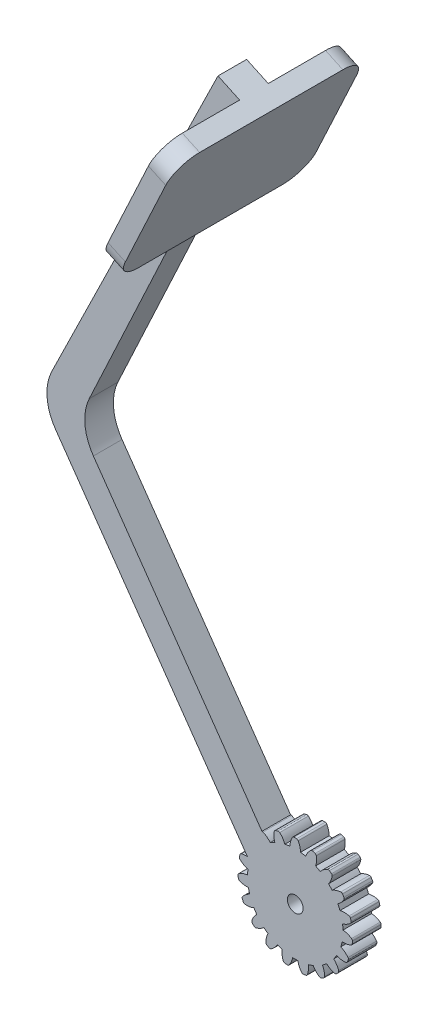
from build123d import *

# Parameters (mm, degrees)
SKETCH1_R                = 1.5
BOSS_EXTRUDE1_DEPTH      = 6
CIRPATTERN1_COUNT        = 19
BOSS_EXTRUDE2_DEPTH      = 6
CUT_EXTRUDE1_START       = -3
CUT_EXTRUDE1_OUTLINE_R   = 1.5
CUT_EXTRUDE1_DEPTH       = 3
CUT_EXTRUDE2_DEPTH       = 152.502415384
CUT_EXTRUDE2_DEPTH_BACK  = 152.502415384
SKETCH5_R                = 4.5
CUT_EXTRUDE3_DEPTH       = 152.413281671
CUT_EXTRUDE3_DEPTH_BACK  = 152.413281671
SKETCH6_R                = 1
BOSS_EXTRUDE3_DEPTH      = 3
BOSS_EXTRUDE3_DEPTH_BACK = 1
BOSS_EXTRUDE4_START      = -3
SKETCH8_R                = 1.65
BOSS_EXTRUDE4_DEPTH      = 6


# Read off the part's stored shape, not the designer's step: Cut-Extrude1
with BuildPart() as part:
    # Sketch1 → Boss-Extrude1 (new body)
    with BuildSketch(Plane.XY):
        with BuildLine():
            ThreePointArc((-1.1, 9.939315872), (0, -10), (1.1, 9.939315872))
            add(Edge.make_bspline(
                [(0.617344331, 11.790234813), (0.935178871, 11.214473497), (1.097039467, 10.593317902), (1.1, 9.939315872)],
                knots=[0.104246354, 0.104246354, 0.104246354, 0.104246354, 1, 1, 1, 1], degree=3))
            ThreePointArc((0.617344331, 11.790234813), (0.47442802, 11.939032873), (0.276370142, 11.996817059))
            ThreePointArc((0.276370142, 11.996817059), (0, 12), (-0.276370142, 11.996817059))
            ThreePointArc((-0.276370142, 11.996817059), (-0.47442802, 11.939032873), (-0.617344331, 11.790234813))
            add(Edge.make_bspline(
                [(-0.617344331, 11.790234813), (-0.935178871, 11.214473497), (-1.097039467, 10.593317902), (-1.1, 9.939315872)],
                knots=[0.104246354, 0.104246354, 0.104246354, 0.104246354, 1, 1, 1, 1], degree=3))
        make_face()
        Circle(SKETCH1_R, mode=Mode.SUBTRACT)
    boss_extrude1 = extrude(amount=BOSS_EXTRUDE1_DEPTH)

    # CirPattern1: Boss-Extrude1 ×19 about axis
    cirpattern1_axis = Axis((0, 0, 6), (0, 0, -1))
    for i in range(1, CIRPATTERN1_COUNT):
        add(boss_extrude1.rotate(cirpattern1_axis, i * 360 / CIRPATTERN1_COUNT))

    # Sketch2 → Boss-Extrude2 (add)
    with BuildSketch(Plane.XY.offset(6)):
        with BuildLine():
            Line((-2.585087734, 3.441458618), (-42.291775361, 60.148485407))
            ThreePointArc((-42.291775361, 60.148485407), (-44.062201899, 65.012692343), (-43.163332789, 70.110432388))
            Line((-43.163332789, 70.110432388), (-10.747026783, 139.627424955))
            Line((-10.747026783, 139.627424955), (-16.184873505, 142.163134526))
            Line((-16.184873505, 142.163134526), (-51.004148383, 71.143782801))
            ThreePointArc((-51.004148383, 71.143782801), (-51.995208494, 65.967264138), (-50.21675479, 61.005848207))
            Line((-50.21675479, 61.005848207), (-7.5, 0))
            Line((-7.5, 0), (-2.585087734, 3.441458618))
        make_face()
    extrude(amount=-BOSS_EXTRUDE2_DEPTH)

    # Cut-Extrude1 outline → Cut-Extrude1 (cut)
    with BuildSketch(Plane.XY.offset(6).offset(CUT_EXTRUDE1_START)):
        with BuildLine():
            Line((5.737256394, -3.055141415), (9.986319648, -0.522895679))
            ThreePointArc((9.986319648, -0.522895679), (9.999233448, -0.123816169), (9.996205349, 0.275460743))
            ThreePointArc((9.996205349, 0.275460743), (9.96584493, 0.825793455), (9.905209485, 1.373617506))
            ThreePointArc((9.905209485, 1.373617506), (9.694002659, 2.454854871), (9.365141414, 3.506298091))
            ThreePointArc((9.365141414, 3.506298091), (9.157733267, 4.016954247), (8.922505039, 4.515407383))
            ThreePointArc((8.922505039, 4.515407383), (8.371664783, 5.469481581), (7.719219091, 6.357173635))
            ThreePointArc((7.719219091, 6.357173635), (7.357239107, 6.772815716), (6.972908724, 7.167882806))
            ThreePointArc((6.972908724, 7.167882806), (6.914425734, 7.224314277), (6.855486062, 7.280268598))
            Line((6.855486062, 7.280268598), (2.034530077, 6.173385405))
            ThreePointArc((2.034530077, 6.173385405), (-2.420414622, 6.032544493), (-5.737256394, 3.055141415))
            Line((-5.737256394, 3.055141415), (-9.986319648, 0.522895679))
            ThreePointArc((-9.986319648, 0.522895679), (-9.992028439, 0.399208812), (-9.996205349, 0.275460743))
            ThreePointArc((-9.996205349, 0.275460743), (-9.96584493, -0.825793455), (-9.814530789, -1.917025141))
            ThreePointArc((-9.814530789, -1.917025141), (-9.694002659, -2.454854871), (-9.544025328, -2.985227051))
            ThreePointArc((-9.544025328, -2.985227051), (-9.157733267, -4.016954247), (-8.660295394, -4.999928369))
            ThreePointArc((-8.660295394, -4.999928369), (-8.371664783, -5.469481581), (-8.057602071, -5.922419173))
            ThreePointArc((-8.057602071, -5.922419173), (-7.487388609, -6.628650829), (-6.855486062, -7.280268598))
            Line((-6.855486062, -7.280268598), (-2.034530077, -6.173385405))
            ThreePointArc((-2.034530077, -6.173385405), (2.420414622, -6.032544493), (5.737256394, -3.055141415))
        make_face()
        Circle(CUT_EXTRUDE1_OUTLINE_R, mode=Mode.SUBTRACT)
    extrude(amount=CUT_EXTRUDE1_DEPTH, mode=Mode.SUBTRACT)

    # Sketch5 → Cut-Extrude2 (cut, two sides: drawn at the far end of the back side and taken through both)
    with BuildSketch(Plane(origin=(0, 0, 0), x_dir=(-1, 0, 0), z_dir=(0, 0, -1)).offset(-CUT_EXTRUDE2_DEPTH_BACK)):
        with Locations(Location((0, 0, 0), (0, 0, 180))):
            Circle(SKETCH5_R)
    extrude(amount=CUT_EXTRUDE2_DEPTH + CUT_EXTRUDE2_DEPTH_BACK, mode=Mode.SUBTRACT)

    # Sketch6 → Cut-Extrude3 (cut, two sides: drawn at the far end of the back side and taken through both)
    with BuildSketch(Plane.XY.offset(3).offset(-CUT_EXTRUDE3_DEPTH_BACK)):
        with Locations((-6.960628261, -2.792786102)):
            Circle(SKETCH6_R)
        with Locations((6.960628261, 2.792786102)):
            Circle(SKETCH6_R)
    extrude(amount=CUT_EXTRUDE3_DEPTH + CUT_EXTRUDE3_DEPTH_BACK, mode=Mode.SUBTRACT)

    # Sketch7 → Boss-Extrude3 (add, two sides: drawn at the far end of the back side and taken through both)
    with BuildSketch(Plane(origin=(-62.307947717, 29.054673184, 0), x_dir=(0, 0, -1), z_dir=(0.9063077870366497, -0.42261826174069994, 0)).offset(-BOSS_EXTRUDE3_DEPTH_BACK)):
        with BuildLine():
            Line((-18, 92.003532743), (12, 92.003532743))
            ThreePointArc((12, 92.003532743), (15.535533906, 93.467998837), (17, 97.003532743))
            Line((17, 97.003532743), (17, 117.003532743))
            ThreePointArc((17, 117.003532743), (15.535533906, 120.539066649), (12, 122.003532743))
            Line((12, 122.003532743), (-18, 122.003532743))
            ThreePointArc((-18, 122.003532743), (-21.535533906, 120.539066649), (-23, 117.003532743))
            Line((-23, 117.003532743), (-23, 97.003532743))
            ThreePointArc((-23, 97.003532743), (-21.535533906, 93.467998837), (-18, 92.003532743))
        make_face()
    extrude(amount=BOSS_EXTRUDE3_DEPTH + BOSS_EXTRUDE3_DEPTH_BACK)

    # Sketch8 → Boss-Extrude4 (add)
    with BuildSketch(Plane.XY.offset(3).offset(BOSS_EXTRUDE4_START)):
        with BuildLine():
            Line((-6.855486062, -7.280268598), (-2.034530077, -6.173385405))
            ThreePointArc((-2.034530077, -6.173385405), (2.420414621, -6.032544493), (5.737256394, -3.055141415))
            Line((5.737256394, -3.055141415), (9.986319648, -0.522895679))
            ThreePointArc((9.986319648, -0.522895679), (9.999233448, -0.123816168), (9.996205349, 0.275460743))
            ThreePointArc((9.996205349, 0.275460743), (9.96584493, 0.825793455), (9.905209485, 1.373617506))
            ThreePointArc((9.905209485, 1.373617506), (9.694002659, 2.454854871), (9.365141414, 3.506298091))
            ThreePointArc((9.365141414, 3.506298091), (9.157733267, 4.016954247), (8.922505039, 4.515407383))
            ThreePointArc((8.922505039, 4.515407383), (8.371664783, 5.469481581), (7.719219091, 6.357173635))
            ThreePointArc((7.719219091, 6.357173635), (7.357239107, 6.772815716), (6.972908724, 7.167882806))
            ThreePointArc((6.972908724, 7.167882806), (6.914425734, 7.224314277), (6.855486062, 7.280268598))
            Line((6.855486062, 7.280268598), (2.034530077, 6.173385405))
            ThreePointArc((2.034530077, 6.173385405), (-2.420414621, 6.032544493), (-5.737256394, 3.055141415))
            Line((-5.737256394, 3.055141415), (-9.986319648, 0.522895679))
            ThreePointArc((-9.986319648, 0.522895679), (-9.992028439, 0.399208812), (-9.996205349, 0.275460743))
            ThreePointArc((-9.996205349, 0.275460743), (-9.96584493, -0.825793455), (-9.814530789, -1.917025141))
            ThreePointArc((-9.814530789, -1.917025141), (-9.694002659, -2.454854871), (-9.544025328, -2.985227051))
            ThreePointArc((-9.544025328, -2.985227051), (-9.157733267, -4.016954247), (-8.660295394, -4.999928369))
            ThreePointArc((-8.660295394, -4.999928369), (-8.371664783, -5.469481581), (-8.057602071, -5.922419173))
            ThreePointArc((-8.057602071, -5.922419173), (-7.487388609, -6.628650829), (-6.855486062, -7.280268598))
        make_face()
        Circle(SKETCH8_R, mode=Mode.SUBTRACT)
    extrude(amount=BOSS_EXTRUDE4_DEPTH)


solid = part.part
